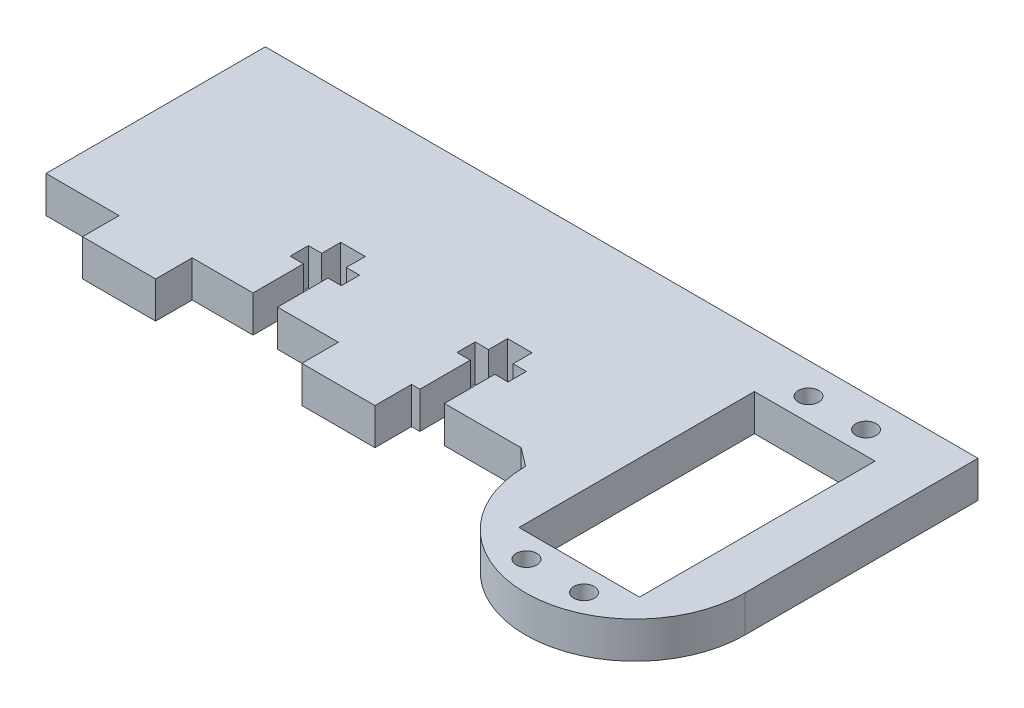
from build123d import *

# Parameters (mm, degrees)
BOSS_EXTRUDE1_DEPTH = 6.35
CUT_EXTRUDE1_DEPTH  = 79.730852648
SKETCH4_W           = 20.950480973
SKETCH4_H           = 40.91890815
CUT_EXTRUDE2_DEPTH  = 77.58782296
SKETCH5_R           = 1.778
SKETCH5_W           = 123.825
SKETCH5_H           = 19.05
CUT_EXTRUDE3_DEPTH  = 77.58782296
CUT_EXTRUDE4_DEPTH  = 72.331361548


with BuildPart() as part:
    # Sketch1 → Boss-Extrude1 (new body)
    with BuildSketch(Plane(origin=(0, 0, 0), x_dir=(1, 0, 0), z_dir=(0, 1, 0))):
        Polygon((64.810443043, 44.247385587), (64.810443043, -38.302614413), (20.360443043, -38.302614413), (20.360443043, -12.902614413), (1.310443043, -12.902614413), (1.310443043, -19.252614413), (-11.389556957, -19.252614413), (-11.389556957, -12.902614413), (-36.789556957, -12.902614413), (-36.789556957, -19.252614413), (-49.489556957, -19.252614413), (-49.489556957, -12.902614413), (-62.189556957, -12.902614413), (-62.189556957, 44.247385587), align=None)
    extrude(amount=BOSS_EXTRUDE1_DEPTH)

    # Sketch2 → Cut-Extrude1 (cut, through all)
    with BuildSketch(Plane.XZ):
        with BuildLine():
            Line((20.360443043, 12.902614413), (23.535443043, 15.30548931))
            ThreePointArc((23.535443043, 15.30548931), (42.585443043, 34.35548931), (61.635443043, 15.30548931))
            Line((61.635443043, 15.30548931), (61.635443043, -44.247385587))
            Line((61.635443043, -44.247385587), (64.810443043, -44.247385587))
            Line((64.810443043, -44.247385587), (64.810443043, 38.302614413))
            Line((64.810443043, 38.302614413), (20.360443043, 38.302614413))
            Line((20.360443043, 38.302614413), (20.360443043, 12.902614413))
        make_face()
    extrude(amount=-CUT_EXTRUDE1_DEPTH, mode=Mode.SUBTRACT)

    # Sketch4 → Cut-Extrude2 (cut, through all)
    with BuildSketch(Plane.XZ):
        with Locations((42.642368246, 4.632403749)):
            Rectangle(SKETCH4_W, SKETCH4_H)
    extrude(amount=-CUT_EXTRUDE2_DEPTH, mode=Mode.SUBTRACT)

    # Sketch5 → Cut-Extrude3 (cut, through all)
    with BuildSketch(Plane(origin=(0, 6.35, 0), x_dir=(1, 0, 0), z_dir=(0, 1, 0))):
        with Locations((47.585443043, -29.20098931)):
            Circle(SKETCH5_R)
        with Locations((37.585443043, -29.20098931)):
            Circle(SKETCH5_R)
        with Locations((47.585443043, 19.79901069)):
            Circle(SKETCH5_R)
        with Locations((37.585443043, 19.79901069)):
            Circle(SKETCH5_R)
        with Locations((-0.277056957, 34.722385587)):
            Rectangle(SKETCH5_W, SKETCH5_H)
    extrude(amount=-CUT_EXTRUDE3_DEPTH, mode=Mode.SUBTRACT)

    # Sketch6 → Cut-Extrude4 (cut, through all)
    with BuildSketch(Plane(origin=(0, 6.35, 0), x_dir=(1, 0, 0), z_dir=(0, 1, 0))):
        Polygon((2.758977506, -12.902614413), (7.026177506, -12.902614413), (7.026177506, -4.139614413), (9.337577506, -4.139614413), (9.337577506, -0.964614413), (7.026177506, -0.964614413), (7.026177506, 2.337385587), (2.758977506, 2.337385587), (2.758977506, -0.964614413), (0.447577506, -0.964614413), (0.447577506, -4.139614413), (2.758977506, -4.139614413), align=None)
        Polygon((-26.223156957, -12.902614413), (-21.955956957, -12.902614413), (-21.955956957, -4.139614413), (-19.644556957, -4.139614413), (-19.644556957, -0.964614413), (-21.955956957, -0.964614413), (-21.955956957, 2.337385587), (-26.223156957, 2.337385587), (-26.223156957, -0.964614413), (-28.534556957, -0.964614413), (-28.534556957, -4.139614413), (-26.223156957, -4.139614413), align=None)
    extrude(amount=-CUT_EXTRUDE4_DEPTH, mode=Mode.SUBTRACT)


solid = part.part
